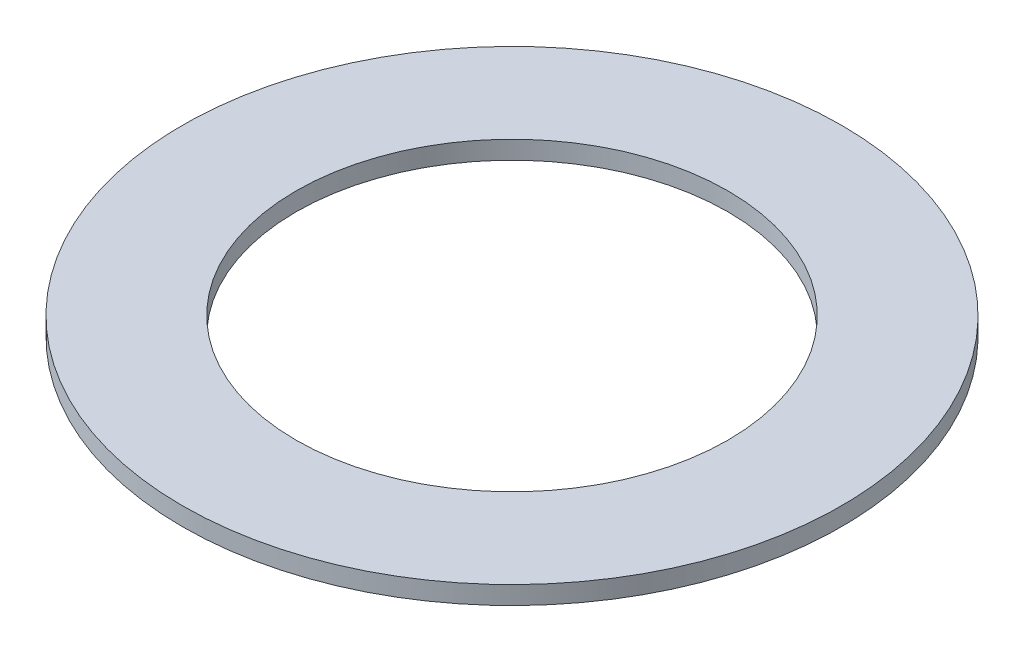
from build123d import *

# Parameters (mm, degrees)
SKETCH1_R           = 72.5
BOSS_EXTRUDE1_DEPTH = 4
SKETCH2_R           = 47.5
CUT_EXTRUDE1_DEPTH  = 103.608479182


with BuildPart() as part:
    # Sketch1 → Boss-Extrude1 (new body)
    with BuildSketch(Plane(origin=(0, 0, 0), x_dir=(1, 0, 0), z_dir=(0, 1, 0))):
        Circle(SKETCH1_R)
    extrude(amount=BOSS_EXTRUDE1_DEPTH)

    # Sketch2 → Cut-Extrude1 (cut, through all)
    with BuildSketch(Plane(origin=(0, 0, 0), x_dir=(1, 0, 0), z_dir=(0, 1, 0))):
        Circle(SKETCH2_R)
    extrude(amount=CUT_EXTRUDE1_DEPTH, mode=Mode.SUBTRACT)


solid = part.part
